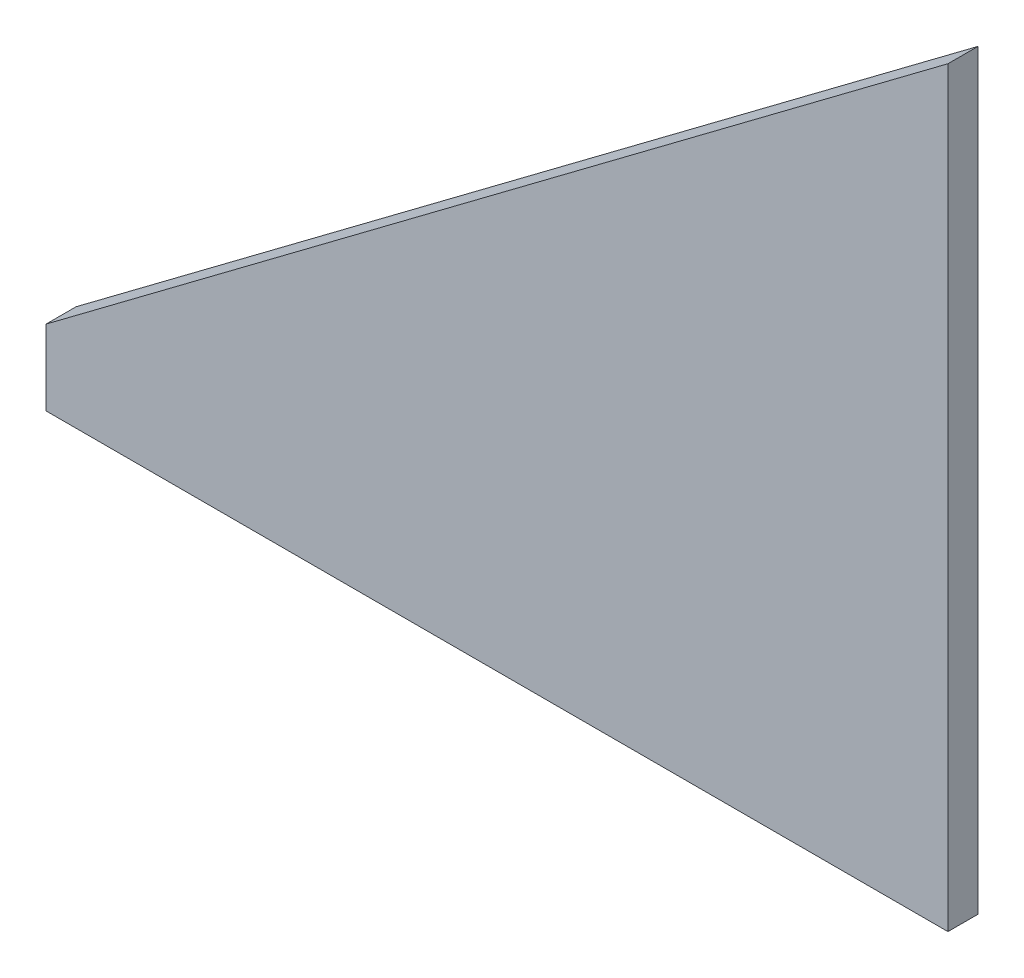
from build123d import *

# Parameters (mm, degrees)
BOSS_EXTRUDE1_DEPTH = 10


with BuildPart() as part:
    # Sketch1 → Boss-Extrude1 (new body)
    with BuildSketch(Plane.XY):
        Polygon((-350, -1957.963482806), (-350, -1707.963482806), (-650, -1932.963482806), (-650, -1957.963482806), align=None)
    extrude(amount=BOSS_EXTRUDE1_DEPTH)


solid = part.part
